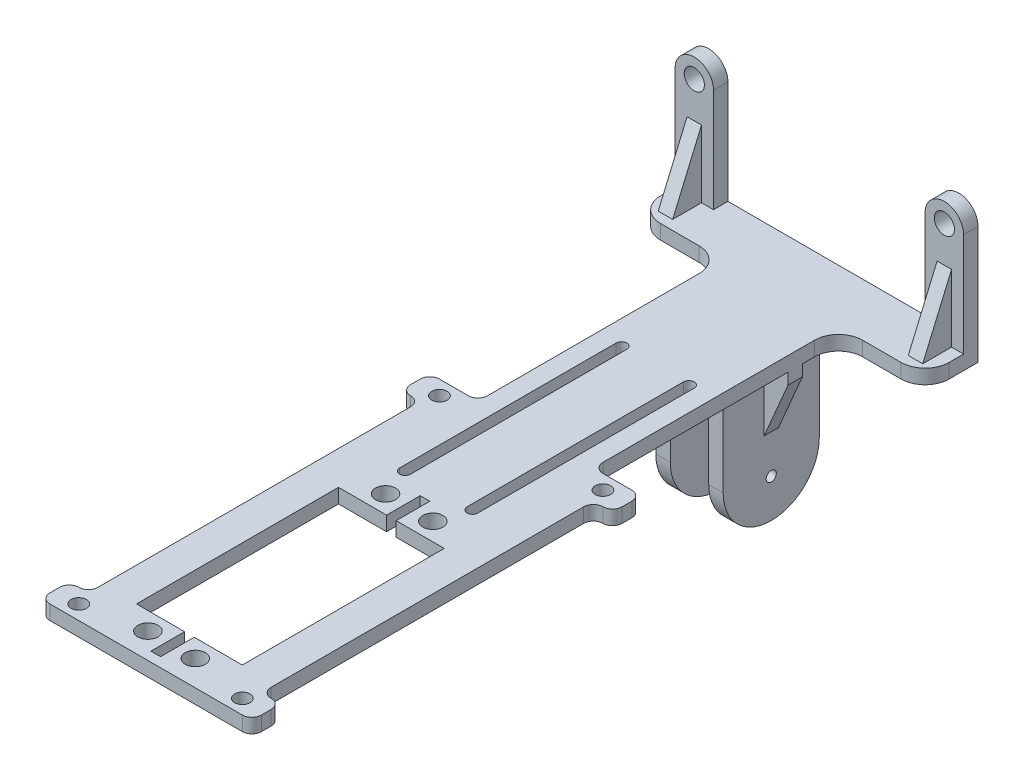
from build123d import *

# Parameters (mm, degrees)
SKETCH_1_R           = 2.1
EXTRUDE_1_DEPTH      = 3
SKETCH_2_W           = 60
SKETCH_2_H           = 3
EXTRUDE_2_DEPTH      = 80
SKETCH_3_W           = 60
SKETCH_3_H           = 3
EXTRUDE_3_DEPTH      = 60
SKETCH_4_R           = 2.1
SKETCH_4_W           = 22
SKETCH_4_H           = 42
CUT_EXTRUDE_1_DEPTH  = 149.321441471
SKETCH_5_W           = 14
SKETCH_5_H           = 20
EXTRUDE_4_DEPTH      = 30
SKETCH_6_W           = 8
SKETCH_6_H           = 30
CUT_EXTRUDE_2_DEPTH  = 129.993216876
SKETCH_7_R           = 1.05
CUT_EXTRUDE_3_DEPTH  = 158.442846773
SKETCH_8_W           = 2
SKETCH_8_H           = 7
CUT_EXTRUDE_4_DEPTH  = 150.793190766
SKETCH_9_W           = 12
SKETCH_9_H           = 132
CUT_EXTRUDE_5_DEPTH  = 150.793190766
SKETCH_12_W          = 4
SKETCH_12_H          = 6
EXTRUDE_5_DEPTH      = 3
SKETCH_13_R          = 1.6
CUT_EXTRUDE_8_DEPTH  = 150.793190766
RIB_25_REACH         = 164.958
SKETCH_19_WALL_W     = 343.147179466
SKETCH_19_WALL_H     = 3
RIB_30_REACH         = 164.958
SKETCH_20_WALL_W     = 343.147179466
SKETCH_20_WALL_H     = 3
RIB_38_REACH         = 139.838
SKETCH_21_WALL_W     = 292.907080128
SKETCH_21_WALL_H     = 3
RIB_39_REACH         = 139.838
SKETCH_22_WALL_W     = 292.907080128
SKETCH_22_WALL_H     = 3
CUT_EXTRUDE_9_DEPTH  = 150.793190766
SKETCH_24_W          = 6
SKETCH_24_H          = 51
CUT_EXTRUDE_10_DEPTH = 150.793190766
FILLET_1_R           = 5
FILLET_2_R           = 2
FILLET_3_R           = 10


with BuildPart() as part:
    # 草图1 → 凸台-拉伸1 (new body)
    with BuildSketch(Plane.XY):
        with BuildLine():
            Line((-22, 0), (-22, -21.5))
            Line((-22, -21.5), (22, -21.5))
            Line((22, -21.5), (22, 0))
            ThreePointArc((22, 0), (26, 4), (30, 0))
            Line((30, 0), (30, -24.5))
            Line((30, -24.5), (-30, -24.5))
            Line((-30, -24.5), (-30, 0))
            ThreePointArc((-30, 0), (-26, 4), (-22, 0))
        make_face()
        with Locations((-26, 0)):
            Circle(SKETCH_1_R, mode=Mode.SUBTRACT)
        with Locations((26, 0)):
            Circle(SKETCH_1_R, mode=Mode.SUBTRACT)
    extrude(amount=EXTRUDE_1_DEPTH)

    # 草图2 → 凸台-拉伸2 (add)
    with BuildSketch(Plane.XY.offset(3)):
        with Locations((0, -23)):
            Rectangle(SKETCH_2_W, SKETCH_2_H)
    extrude(amount=EXTRUDE_2_DEPTH)

    # 草图3 → 凸台-拉伸3 (add)
    with BuildSketch(Plane.XY.offset(83)):
        with Locations((0, -23)):
            Rectangle(SKETCH_3_W, SKETCH_3_H)
    extrude(amount=EXTRUDE_3_DEPTH)

    # 草图4 → 切除-拉伸1 (cut, through all)
    with BuildSketch(Plane(origin=(0, -21.5, 0), x_dir=(1, 0, 0), z_dir=(0, 1, 0))):
        with Locations(Location((-4.925, -88.29, 0), (0, 0, 270))):
            Circle(SKETCH_4_R)
        with Locations(Location((4.925, -88.29, 0), (0, 0, 270))):
            Circle(SKETCH_4_R)
        with Locations(Location((-4.925, -137.71, 0), (0, 0, 270))):
            Circle(SKETCH_4_R)
        with Locations(Location((4.925, -137.71, 0), (0, 0, 270))):
            Circle(SKETCH_4_R)
        with Locations((0, -113)):
            Rectangle(SKETCH_4_W, SKETCH_4_H)
    extrude(amount=-CUT_EXTRUDE_1_DEPTH, mode=Mode.SUBTRACT)

    # 草图5 → 凸台-拉伸4 (add)
    with BuildSketch(Plane.XZ.offset(24.5)):
        with Locations((0, 20)):
            Rectangle(SKETCH_5_W, SKETCH_5_H)
    extrude(amount=EXTRUDE_4_DEPTH)

    # 草图6 → 切除-拉伸2 (cut, through all)
    with BuildSketch(Plane.XY.offset(30)):
        with Locations((0, -39.5)):
            Rectangle(SKETCH_6_W, SKETCH_6_H)
    extrude(amount=-CUT_EXTRUDE_2_DEPTH, mode=Mode.SUBTRACT)

    # 草图7 → 切除-拉伸3 (cut, through all)
    with BuildSketch(Plane(origin=(7, 0, 0), x_dir=(0, 0, -1), z_dir=(1, 0, 0))):
        with Locations((-20, -46.5)):
            Circle(SKETCH_7_R)
    extrude(amount=-CUT_EXTRUDE_3_DEPTH, mode=Mode.SUBTRACT)

    # 草图8 → 切除-拉伸4 (cut, through all)
    with BuildSketch(Plane(origin=(0, -21.5, 0), x_dir=(1, 0, 0), z_dir=(0, 1, 0))):
        with Locations((0, -88.5)):
            Rectangle(SKETCH_8_W, SKETCH_8_H)
        with Locations((0, -137.5)):
            Rectangle(SKETCH_8_W, SKETCH_8_H)
    extrude(amount=-CUT_EXTRUDE_4_DEPTH, mode=Mode.SUBTRACT)

    # 草图9 → 切除-拉伸5 (cut, through all)
    with BuildSketch(Plane(origin=(0, -21.5, 0), x_dir=(1, 0, 0), z_dir=(0, 1, 0))):
        with Locations((24, -77)):
            Rectangle(SKETCH_9_W, SKETCH_9_H)
        with Locations((-24, -77)):
            Rectangle(SKETCH_9_W, SKETCH_9_H)
    extrude(amount=-CUT_EXTRUDE_5_DEPTH, mode=Mode.SUBTRACT)

    # 草图12 → 凸台-拉伸5 (add)
    with BuildSketch(Plane(origin=(0, -21.5, 0), x_dir=(1, 0, 0), z_dir=(0, 1, 0))):
        with Locations((20, -140)):
            Rectangle(SKETCH_12_W, SKETCH_12_H)
        with Locations((-20, -140)):
            Rectangle(SKETCH_12_W, SKETCH_12_H)
        with Locations((-20, -65)):
            Rectangle(SKETCH_12_W, SKETCH_12_H)
        with Locations((20, -65)):
            Rectangle(SKETCH_12_W, SKETCH_12_H)
    extrude(amount=-EXTRUDE_5_DEPTH)

    # 草图13 → 切除-拉伸8 (cut, through all)
    with BuildSketch(Plane(origin=(0, -21.5, 0), x_dir=(1, 0, 0), z_dir=(0, 1, 0))):
        with Locations(Location((-17, -140, 0), (0, 0, 270))):
            Circle(SKETCH_13_R)
        with Locations(Location((17, -140, 0), (0, 0, 270))):
            Circle(SKETCH_13_R)
        with Locations(Location((-17, -65, 0), (0, 0, 270))):
            Circle(SKETCH_13_R)
        with Locations(Location((17, -65, 0), (0, 0, 270))):
            Circle(SKETCH_13_R)
    extrude(amount=-CUT_EXTRUDE_8_DEPTH, mode=Mode.SUBTRACT)

    # 草图19 wall → 筋25 (add, up to next)
    with BuildSketch(Plane(origin=(-26, -14.5, 6), x_dir=(0, -0.919145030018, 0.393919298579), z_dir=(0, 0.393919298579, 0.919145030018)), mode=Mode.PRIVATE) as rib_25_sk1:
        Rectangle(SKETCH_19_WALL_W, SKETCH_19_WALL_H)
    rib_25_tool1 = extrude(rib_25_sk1.sketch, amount=-RIB_25_REACH, mode=Mode.PRIVATE) - part.part
    add(rib_25_tool1.solids().sort_by_distance((-26, -14.5, 6))[0])

    # 草图20 wall → 筋30 (add, up to next)
    with BuildSketch(Plane(origin=(26, -14.5, 6), x_dir=(0, -0.919145030018, 0.393919298579), z_dir=(0, -0.393919298579, -0.919145030018)), mode=Mode.PRIVATE) as rib_30_sk1:
        Rectangle(SKETCH_20_WALL_W, SKETCH_20_WALL_H)
    rib_30_tool1 = extrude(rib_30_sk1.sketch, amount=RIB_30_REACH, mode=Mode.PRIVATE) - part.part
    add(rib_30_tool1.solids().sort_by_distance((26, -14.5, 6))[0])

    # 草图21 wall → 筋38 (add, up to next)
    with BuildSketch(Plane(origin=(-10, -31.5, 20), x_dir=(0.393919298579, -0.919145030018, 0), z_dir=(0.919145030018, 0.393919298579, 0)), mode=Mode.PRIVATE) as rib_38_sk1:
        Rectangle(SKETCH_21_WALL_W, SKETCH_21_WALL_H)
    rib_38_tool1 = extrude(rib_38_sk1.sketch, amount=RIB_38_REACH, mode=Mode.PRIVATE) - part.part
    add(rib_38_tool1.solids().sort_by_distance((-10, -31.5, 20))[0])

    # 草图22 wall → 筋39 (add, up to next)
    with BuildSketch(Plane(origin=(10, -31.5, 20), x_dir=(-0.393919298579, -0.919145030018, 0), z_dir=(0.919145030018, -0.393919298579, 0)), mode=Mode.PRIVATE) as rib_39_sk1:
        Rectangle(SKETCH_22_WALL_W, SKETCH_22_WALL_H)
    rib_39_tool1 = extrude(rib_39_sk1.sketch, amount=-RIB_39_REACH, mode=Mode.PRIVATE) - part.part
    add(rib_39_tool1.solids().sort_by_distance((10, -31.5, 20))[0])

    # 草图23 → 切除-拉伸9 (cut, through all)
    with BuildSketch(Plane(origin=(0, -21.5, 0), x_dir=(1, 0, 0), z_dir=(0, 1, 0))):
        with BuildLine():
            Line((-5.875, -37.143702513), (-5.875, -82.143702513))
            ThreePointArc((-5.875, -82.143702513), (-7, -83.268702513), (-8.125, -82.143702513))
            Line((-8.125, -82.143702513), (-8.125, -37.143702513))
            ThreePointArc((-8.125, -37.143702513), (-7, -36.018702513), (-5.875, -37.143702513))
        make_face()
        with BuildLine():
            Line((8.125, -37.143702513), (8.125, -82.143702513))
            ThreePointArc((8.125, -82.143702513), (7, -83.268702513), (5.875, -82.143702513))
            Line((5.875, -82.143702513), (5.875, -37.143702513))
            ThreePointArc((5.875, -37.143702513), (7, -36.018702513), (8.125, -37.143702513))
        make_face()
    extrude(amount=-CUT_EXTRUDE_9_DEPTH, mode=Mode.SUBTRACT)

    # 草图24 → 切除-拉伸10 (cut, through all)
    with BuildSketch(Plane(origin=(0, -21.5, 0), x_dir=(1, 0, 0), z_dir=(0, 1, 0))):
        with Locations((-15, -36.5)):
            Rectangle(SKETCH_24_W, SKETCH_24_H)
        with Locations((15, -36.5)):
            Rectangle(SKETCH_24_W, SKETCH_24_H)
    extrude(amount=-CUT_EXTRUDE_10_DEPTH, mode=Mode.SUBTRACT)

    # 圆角1
    fillet_1_edges = [part.edges().sort_by_distance(p)[0] for p in [
        (30, -23, 11),
        (-30, -23, 11),
        (-12, -23, 11),
        (12, -23, 11),
    ]]
    fillet(fillet_1_edges, radius=FILLET_1_R)

    # 圆角2
    fillet_2_edges = [part.edges().sort_by_distance(p)[0] for p in [
        (18, -23, 137),
        (22, -23, 137),
        (22, -23, 143),
        (-22, -23, 143),
        (-22, -23, 137),
        (-18, -23, 137),
        (-18, -23, 68),
        (18, -23, 68),
        (22, -23, 68),
        (22, -23, 62),
        (12, -23, 62),
        (-22, -23, 62),
        (-12, -23, 62),
        (-22, -23, 68),
    ]]
    fillet(fillet_2_edges, radius=FILLET_2_R - 0.0001)  # a hair under: the kernel refuses the full size

    # 圆角3
    fillet_3_edges = [part.edges().sort_by_distance(p)[0] for p in [
        (5.5, -54.5, 10),
        (-5.5, -54.5, 10),
        (-5.5, -54.5, 30),
        (5.5, -54.5, 30),
    ]]
    fillet(fillet_3_edges, radius=FILLET_3_R - 0.0001)  # a hair under: the kernel refuses the full size


solid = part.part
